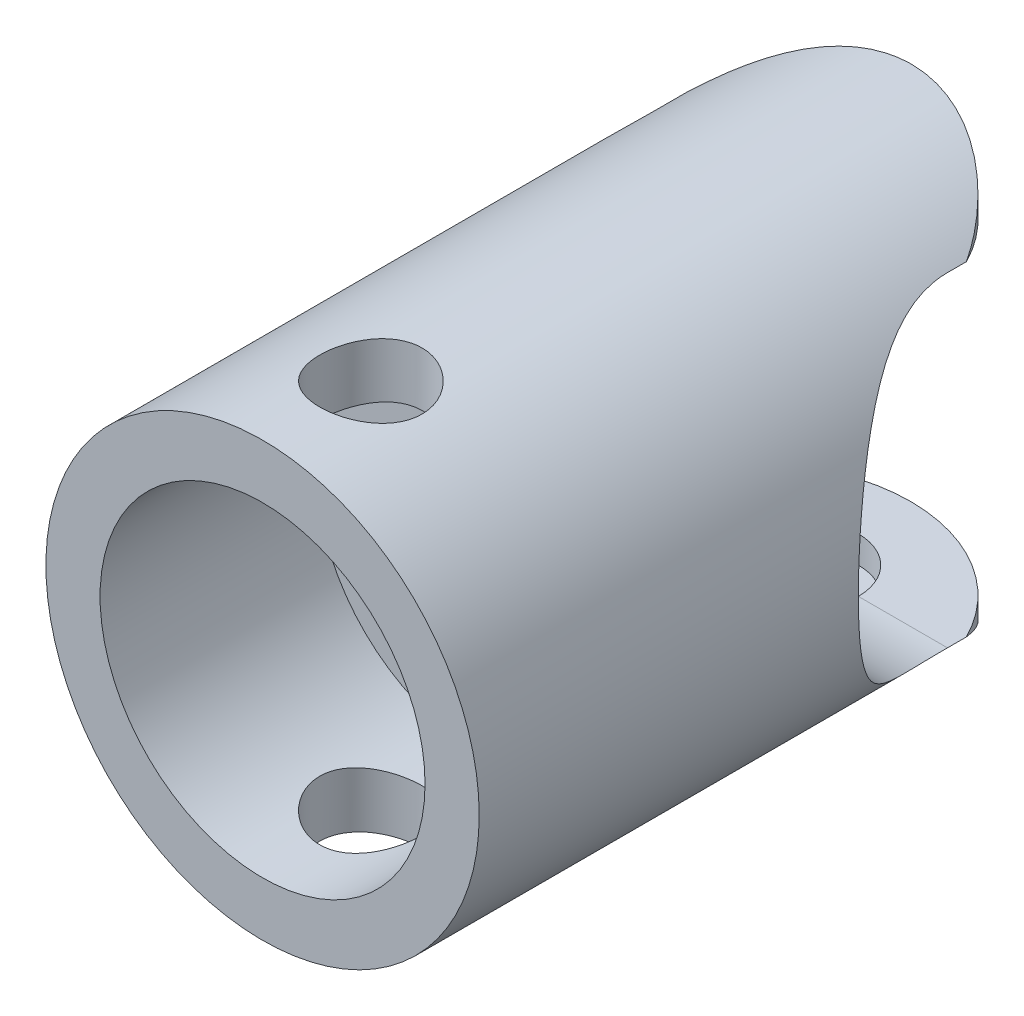
from build123d import *

# Parameters (mm, degrees)
SKETCH1_R               = 12.7
BOSS_EXTRUDE1_DEPTH     = 38.1
CUT_EXTRUDE2_DEPTH      = 48.519048812
CUT_EXTRUDE3_DEPTH      = 38.1
SKETCH4_R               = 9.525
CUT_EXTRUDE4_DEPTH      = 12.7
CUT_EXTRUDE5_DEPTH      = 11.1125
CUT_EXTRUDE5_DEPTH_BACK = 11.1125
SKETCH6_R               = 3.175
SKETCH7_R               = 3
CUT_EXTRUDE6_DEPTH      = 48.519048972


with BuildPart() as part:
    # Sketch1 → Boss-Extrude1 (new body)
    with BuildSketch(Plane.XY):
        Circle(SKETCH1_R)
    extrude(amount=BOSS_EXTRUDE1_DEPTH)

    # Sketch2 → Cut-Extrude2 (cut, through all)
    with BuildSketch(Plane(origin=(12.7, 0, 0), x_dir=(0, 0, -1), z_dir=(1, 0, 0))):
        with BuildLine():
            Line((3.175, 9.525), (-6.35, 9.525))
            ThreePointArc((-6.35, 9.525), (-15.875, 0), (-6.35, -9.525))
            Line((-6.35, -9.525), (3.175, -9.525))
            Line((3.175, -9.525), (3.175, 9.525))
        make_face()
    extrude(amount=-CUT_EXTRUDE2_DEPTH, mode=Mode.SUBTRACT)

    # Sketch3 → Cut-Extrude3 (cut)
    with BuildSketch(Plane(origin=(0, -12.7, 0), x_dir=(-1, 0, 0), z_dir=(0, -1, 0))):
        with BuildLine():
            ThreePointArc((-8.400260413, -5.241151589), (-4.934653756, -1.443317517), (0, 0))
            Line((0, 0), (-8.400260413, 0))
            Line((-8.400260413, 0), (-8.400260413, -5.241151589))
        make_face()
        with BuildLine():
            Line((8.400260413, 0), (0.21470184, 0))
            ThreePointArc((0.21470184, 0), (4.954513337, -1.324965695), (8.400260413, -4.838962595))
            Line((8.400260413, -4.838962595), (8.400260413, 0))
        make_face()
    extrude(amount=-CUT_EXTRUDE3_DEPTH, mode=Mode.SUBTRACT)

    # Sketch4 → Cut-Extrude4 (cut)
    with BuildSketch(Plane.XY.offset(38.1)):
        Circle(SKETCH4_R)
    extrude(amount=-CUT_EXTRUDE4_DEPTH, mode=Mode.SUBTRACT)

    # Sketch6 → Cut-Extrude5 (cut, two sides: drawn at the far end of the back side and taken through both)
    with BuildSketch(Plane(origin=(0, 0, 0), x_dir=(1, 0, 0), z_dir=(0, 1, 0)).offset(-CUT_EXTRUDE5_DEPTH_BACK)):
        with Locations((0, -6.35)):
            Circle(SKETCH6_R)
    extrude(amount=CUT_EXTRUDE5_DEPTH + CUT_EXTRUDE5_DEPTH_BACK, mode=Mode.SUBTRACT)

    # Sketch7 → Cut-Extrude6 (cut, through all)
    with BuildSketch(Plane(origin=(0, -12.7, 0), x_dir=(-1, 0, 0), z_dir=(0, -1, 0))):
        with Locations((0, -31.75)):
            Circle(SKETCH7_R)
    extrude(amount=-CUT_EXTRUDE6_DEPTH, mode=Mode.SUBTRACT)


solid = part.part
